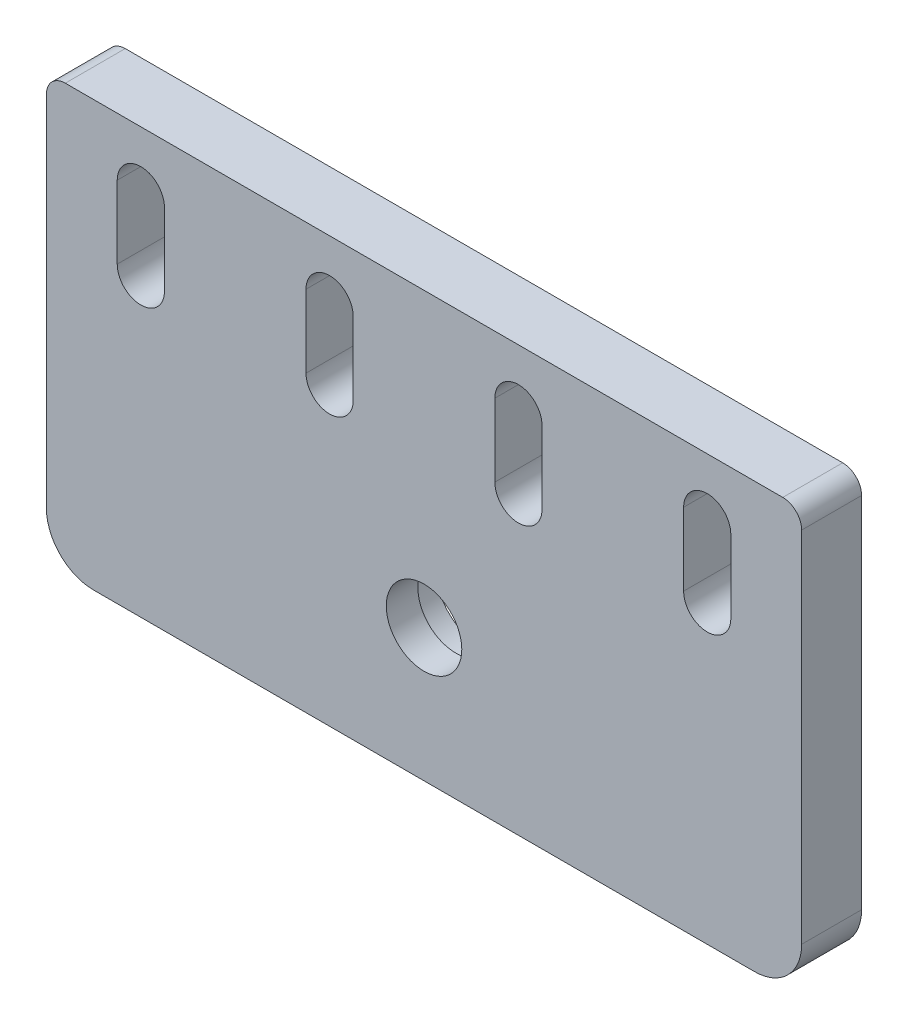
from build123d import *

# Parameters (mm, degrees)
SKETCH1_R                 = 4
BOSS_EXTRUDE1_DEPTH       = 6.35
F_5_0MM_DOWEL_SLOT1_DEPTH = 6.35
SKETCH5_R                 = 5.25
CUT_EXTRUDE1_DEPTH        = 3


# Read off the part's stored shape, not the designer's step: Ø5.0mm Dowel Slot1
with BuildPart() as part:
    # Sketch1 → Boss-Extrude1 (new body)
    with BuildSketch(Plane.XY):
        with BuildLine():
            Line((-27.999999098, 10), (48.000000902, 10))
            ThreePointArc((48.000000902, 10), (49.414214465, 9.414213562), (50.000000902, 8))
            Line((50.000000902, 8), (50.000000902, -30))
            ThreePointArc((50.000000902, -30), (48.535534808, -33.535533906), (45.000000902, -35))
            Line((45.000000902, -35), (-24.999999098, -35))
            ThreePointArc((-24.999999098, -35), (-28.535533003, -33.535533906), (-29.999999098, -30))
            Line((-29.999999098, -30), (-29.999999098, 8))
            ThreePointArc((-29.999999098, 8), (-29.41421266, 9.414213562), (-27.999999098, 10))
        make_face()
        with Locations((10.000000902, -20.95)):
            Circle(SKETCH1_R, mode=Mode.SUBTRACT)
    extrude(amount=BOSS_EXTRUDE1_DEPTH)

    # Ø5.0mm Dowel Slot1 outline → Ø5.0mm Dowel Slot1 (cut)
    with BuildSketch(Plane.XY):
        with BuildLine():
            Line((22.500000902, -3.85), (22.500000902, 3.85))
            ThreePointArc((22.500000902, 3.85), (20.000000902, 6.35), (17.500000902, 3.85))
            Line((17.500000902, 3.85), (17.500000902, -3.85))
            ThreePointArc((17.500000902, -3.85), (20.000000902, -6.35), (22.500000902, -3.85))
        make_face()
        with BuildLine():
            Line((-17.499999098, -3.85), (-17.499999098, 3.85))
            ThreePointArc((-17.499999098, 3.85), (-19.999999098, 6.35), (-22.499999098, 3.85))
            Line((-22.499999098, 3.85), (-22.499999098, -3.85))
            ThreePointArc((-22.499999098, -3.85), (-19.999999098, -6.35), (-17.499999098, -3.85))
        make_face()
        with BuildLine():
            Line((2.500000902, -3.85), (2.500000902, 3.85))
            ThreePointArc((2.500000902, 3.85), (9.02e-07, 6.35), (-2.499999098, 3.85))
            Line((-2.499999098, 3.85), (-2.499999098, -3.85))
            ThreePointArc((-2.499999098, -3.85), (9.02e-07, -6.35), (2.500000902, -3.85))
        make_face()
        with BuildLine():
            Line((42.500000902, -3.85), (42.500000902, 3.85))
            ThreePointArc((42.500000902, 3.85), (40.000000902, 6.35), (37.500000902, 3.85))
            Line((37.500000902, 3.85), (37.500000902, -3.85))
            ThreePointArc((37.500000902, -3.85), (40.000000902, -6.35), (42.500000902, -3.85))
        make_face()
    extrude(amount=F_5_0MM_DOWEL_SLOT1_DEPTH, mode=Mode.SUBTRACT)

    # Sketch5 → Cut-Extrude1 (cut)
    with BuildSketch(Plane(origin=(0, 0, 0), x_dir=(-1, 0, 0), z_dir=(0, 0, -1))):
        with Locations((-10.000000902, -20.95)):
            Circle(SKETCH5_R)
    extrude(amount=-CUT_EXTRUDE1_DEPTH, mode=Mode.SUBTRACT)


solid = part.part
